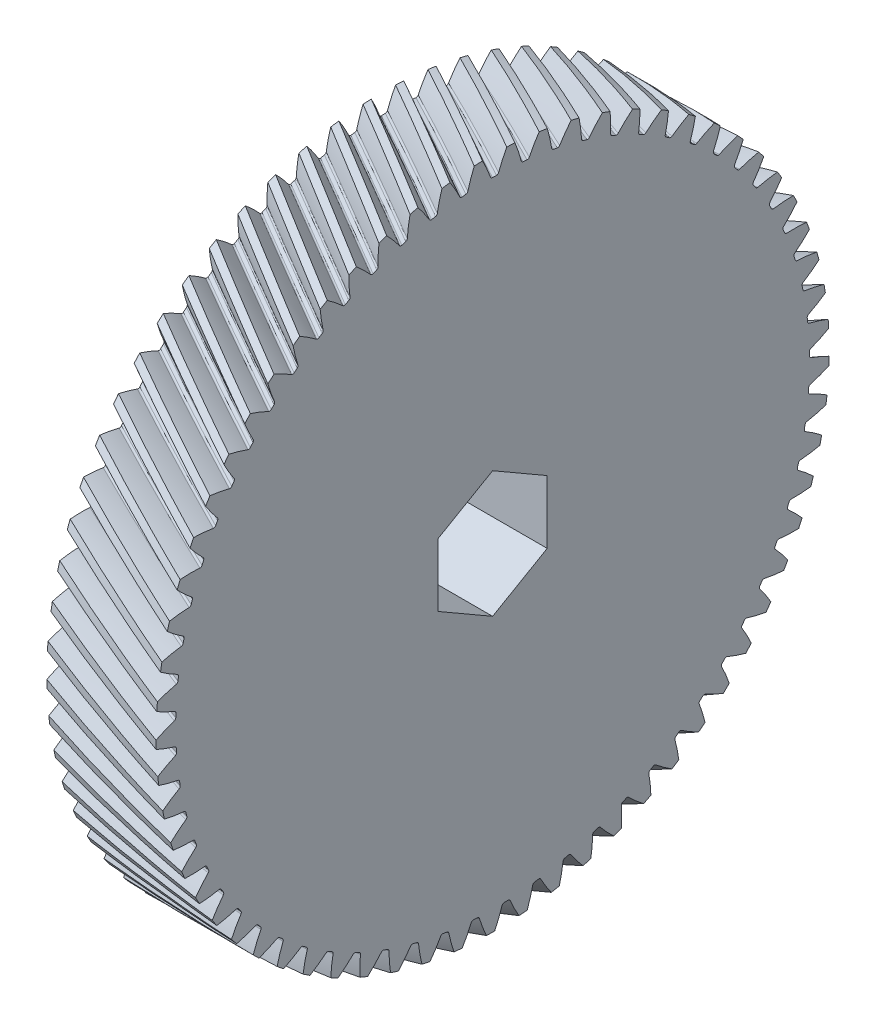
from build123d import *

# Parameters (mm, degrees)
BASPROSKE_W              = 5
BASPROSKE_H              = 15.411106999
TOOTHCUTRH_PITCH         = 167.715936461
TOOTHCUTRH_HEIGHT        = 5
TOOTHCUTRH_RADIUS        = 15.411106999
TOOTHCUTRH_START_ANGLE   = -90
TEETHCUTSRH_COUNT        = 65
TEETHCUTSRH_ANGLE        = 354.461538462
BORSKE_R                 = 2
BORE_DEPTH               = 62.5000025
TAGLIO_ESTRUSIONE1_DEPTH = 10


with BuildPart() as part:
    # BasProSke → Base-Revolve (revolve)
    with BuildSketch(Plane(origin=(0, 0, 0), x_dir=(1, 0, 0), z_dir=(0, 1, 0)), mode=Mode.PRIVATE) as base_revolve_sk:
        with Locations((2.5, 7.7055535)):
            Rectangle(BASPROSKE_W, BASPROSKE_H)
    revolve(base_revolve_sk.sketch.rotate(Axis((-10, 0, 0), (1, 0, 0)), 180), axis=Axis((-10, 0, 0), (1, 0, 0)))

    # ToothCutRH: sweep along a helix
    with BuildLine() as toothcutrh_path:
        add(Helix(TOOTHCUTRH_PITCH, TOOTHCUTRH_HEIGHT, TOOTHCUTRH_RADIUS, center=(0, 0, 0), direction=(1, 0, 0), mode=Mode.PRIVATE).rotate(Axis((0, 0, 0), (1, 0, 0)), TOOTHCUTRH_START_ANGLE))
    # TooCutSkeRH → ToothCutRH (sweep, cut)
    with BuildSketch(Plane(origin=(0, 0, 0), x_dir=(0, 0, -1), z_dir=(1, 0, 0))):
        with BuildLine():
            ThreePointArc((0.091159135, 14.510820664), (0, 14.511106999), (-0.091159135, 14.510820664))
            ThreePointArc((-0.091159135, 14.510820664), (-0.149295312, 14.528785212), (-0.186560758, 14.576887462))
            ThreePointArc((-0.186560758, 14.576887462), (-0.469789912, 15.231985947), (-0.823133428, 15.85208363))
            ThreePointArc((-0.823133428, 15.85208363), (0, 15.873440209), (0.823133428, 15.85208363))
            ThreePointArc((0.823133428, 15.85208363), (0.469789912, 15.231985947), (0.186560758, 14.576887462))
            ThreePointArc((0.186560758, 14.576887462), (0.149295312, 14.528785212), (0.091159135, 14.510820664))
        make_face()
    toothcutrh = sweep(path=toothcutrh_path.line, is_frenet=True, mode=Mode.SUBTRACT)

    # TeethCutsRH: ToothCutRH ×65 about axis
    teethcutsrh_axis = Axis((-10, 0, 0), (1, 0, 0))
    for i in range(1, TEETHCUTSRH_COUNT):
        add(toothcutrh.rotate(teethcutsrh_axis, i * TEETHCUTSRH_ANGLE / (TEETHCUTSRH_COUNT - 1)), mode=Mode.SUBTRACT)

    # BorSke → Bore (cut, symmetric)
    with BuildSketch(Plane(origin=(0, 0, 0), x_dir=(0, 0, -1), z_dir=(1, 0, 0))):
        with Locations(Location((0, 0, 0), (0, 0, 180))):
            Circle(BORSKE_R)
    extrude(amount=BORE_DEPTH, both=True, mode=Mode.SUBTRACT)

    # Schizzo1 → Taglio-Estrusione1 (cut)
    with BuildSketch(Plane(origin=(5, 0, 0), x_dir=(0, 0, -1), z_dir=(1, 0, 0))):
        Polygon((0, 2.886751346), (-2.5, 1.443375673), (-2.5, -1.443375673), (0, -2.886751346), (2.5, -1.443375673), (2.5, 1.443375673), align=None)
    extrude(amount=-TAGLIO_ESTRUSIONE1_DEPTH, mode=Mode.SUBTRACT)


solid = part.part
